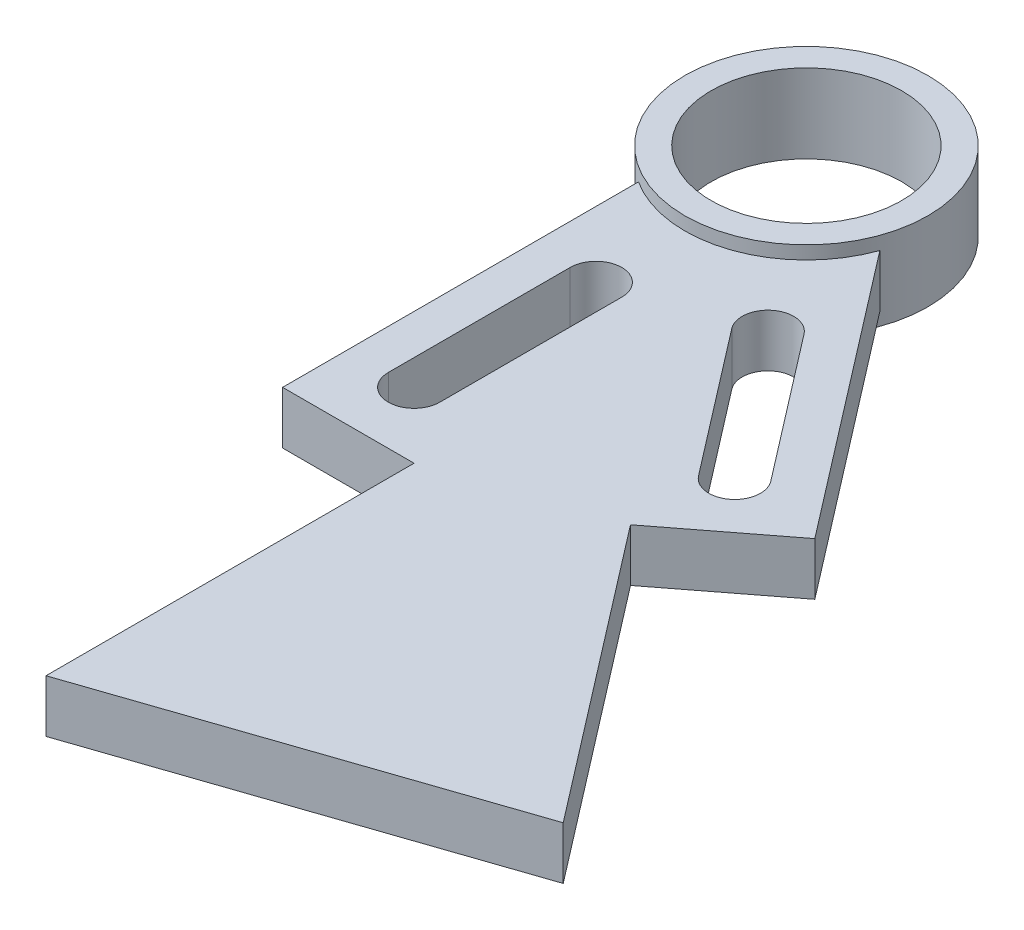
from build123d import *

# Parameters (mm, degrees)
SKETCH1_R             = 11.5062
BEARING_EXTRUDE_DEPTH = 4.7625
BOSS_EXTRUDE2_DEPTH   = 3.175


with BuildPart() as part:
    # Sketch1 → Bearing extrude (new, symmetric)
    with BuildSketch(Plane(origin=(0, 0, 0), x_dir=(1, 0, 0), z_dir=(0, 1, 0))):
        with BuildLine():
            ThreePointArc((14.6812, 0), (-7.035822924, 12.885450292), (-7.9375, -12.350454534))
            ThreePointArc((-7.9375, -12.350454534), (4.727968933, -13.899062674), (13.822036256, -4.94863084))
            ThreePointArc((13.822036256, -4.94863084), (14.464814415, -2.511329803), (14.6812, 0))
        make_face()
        Circle(SKETCH1_R, mode=Mode.SUBTRACT)
    extrude(amount=BEARING_EXTRUDE_DEPTH, both=True)

    # Sketch1<5> → Boss-Extrude2 (add, symmetric)
    with BuildSketch(Plane(origin=(0, 0, 0), x_dir=(1, 0, 0), z_dir=(0, 1, 0))):
        with BuildLine():
            Line((-7.9375, -12.350454534), (-7.9375, -55.3212))
            Line((-7.9375, -55.3212), (7.9375, -55.3212))
            Line((7.9375, -55.3212), (7.9375, -99.7712))
            Line((7.9375, -99.7712), (54.546536045, -83.916456438))
            Line((54.546536045, -83.916456438), (27.442199676, -48.686391863))
            Line((27.442199676, -48.686391863), (33.733282636, -43.846331797))
            Line((33.733282636, -43.846331797), (40.024365596, -39.006271731))
            Line((40.024365596, -39.006271731), (13.822036256, -4.94863084))
            ThreePointArc((13.822036256, -4.94863084), (4.727968933, -13.899062674), (-7.9375, -12.350454534))
        make_face()
        with BuildLine():
            ThreePointArc((3.1115, -47.3837), (0, -50.4952), (-3.1115, -47.3837))
            Line((-3.1115, -47.3837), (-3.1115, -25.4127))
            ThreePointArc((-3.1115, -25.4127), (0, -22.3012), (3.1115, -25.4127))
            Line((3.1115, -25.4127), (3.1115, -47.3837))
        make_face(mode=Mode.SUBTRACT)
        with BuildLine():
            ThreePointArc((31.35932709, -35.657945291), (31.978618002, -37.957451863), (30.790526116, -40.021353358))
            ThreePointArc((30.790526116, -40.021353358), (28.491019544, -40.64064427), (26.427118049, -39.452552383))
            Line((26.427118049, -39.452552383), (13.029831787, -22.03883475))
            ThreePointArc((13.029831787, -22.03883475), (13.598632761, -17.675426684), (17.962040827, -18.244227658))
            Line((17.962040827, -18.244227658), (31.35932709, -35.657945291))
        make_face(mode=Mode.SUBTRACT)
    extrude(amount=BOSS_EXTRUDE2_DEPTH, both=True)


solid = part.part
